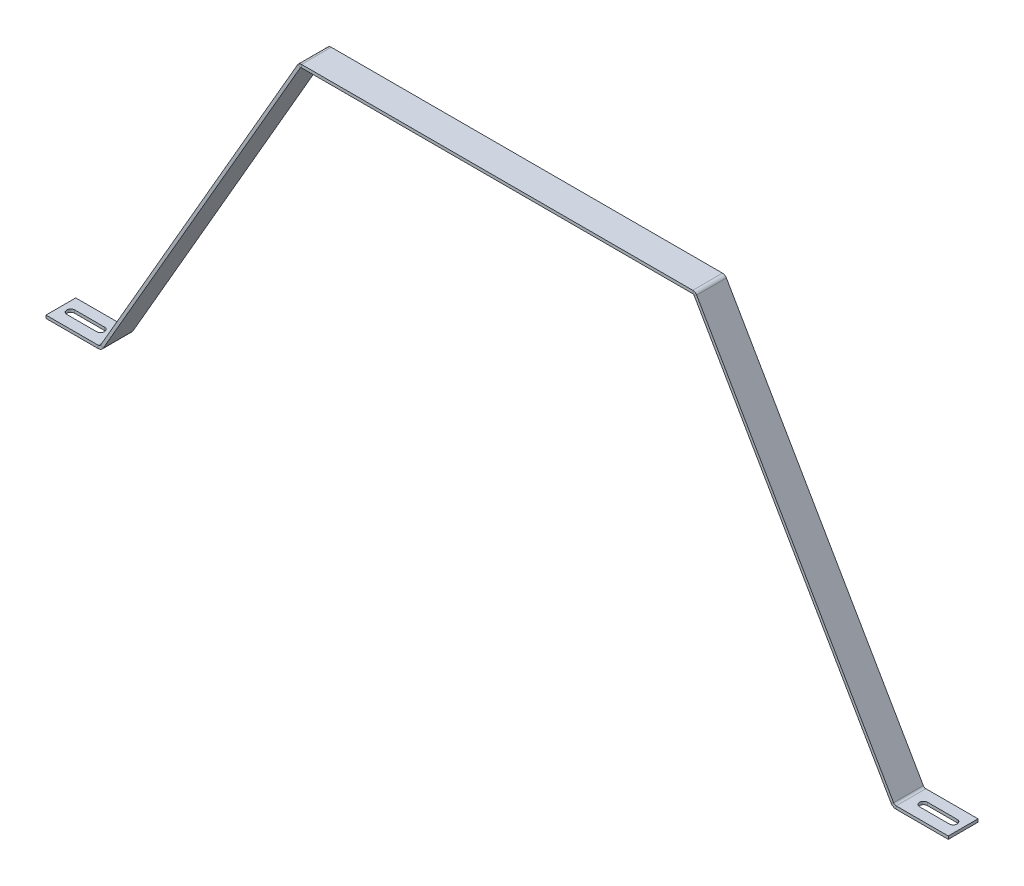
from build123d import *

# Parameters (mm, degrees)
EXTRUDE_1_DEPTH       = 15
CUT_EXTRUDE_1_REACH   = 576.925
SHEET_START           = -15
SHEET_METAL_2_DEPTH   = 30
SHEET_METAL_2_2_DEPTH = 30


# Read off the part's stored shape, not the designer's step: Преобразовать-Твердое тело2
with BuildPart() as part:
    # Эскиз1 → Вытянуть-Тонкостенный1 (new, symmetric)
    with BuildSketch(Plane.XY):
        with BuildLine():
            Line((-455.166025404, 195.187225691), (-402.598076211, 195.187225691))
            ThreePointArc((-402.598076211, 195.187225691), (-401.098076211, 195.58914948), (-400, 196.687225691))
            Line((-400, 196.687225691), (-200.433012702, 542.347387205))
            ThreePointArc((-200.433012702, 542.347387205), (-199.883974596, 542.896425311), (-199.133974596, 543.097387205))
            Line((-199.133974596, 543.097387205), (199.133974596, 543.097387205))
            ThreePointArc((199.133974596, 543.097387205), (199.883974596, 542.896425311), (200.433012702, 542.347387205))
            Line((200.433012702, 542.347387205), (400, 196.687225691))
            ThreePointArc((400, 196.687225691), (401.098076211, 195.58914948), (402.598076211, 195.187225691))
            Line((402.598076211, 195.187225691), (455.166025404, 195.187225691))
            Line((455.166025404, 195.187225691), (455.166025404, 192.187225691))
            Line((455.166025404, 192.187225691), (402.598076211, 192.187225691))
            ThreePointArc((402.598076211, 192.187225691), (399.598076211, 192.991073269), (397.401923789, 195.187225691))
            Line((397.401923789, 195.187225691), (198.267949192, 540.097387205))
            Line((198.267949192, 540.097387205), (-198.267949192, 540.097387205))
            Line((-198.267949192, 540.097387205), (-397.401923789, 195.187225691))
            ThreePointArc((-397.401923789, 195.187225691), (-399.598076211, 192.991073269), (-402.598076211, 192.187225691))
            Line((-402.598076211, 192.187225691), (-455.166025404, 192.187225691))
            Line((-455.166025404, 192.187225691), (-455.166025404, 195.187225691))
        make_face()
    extrude(amount=EXTRUDE_1_DEPTH, both=True)

    # Эскиз2 → Вырез-Вытянуть1 (cut, up to next)
    with BuildSketch(Plane.XZ.offset(-192.187225691), mode=Mode.PRIVATE) as cut_extrude_1_sk1:
        with BuildLine():
            Line((-445.16238786, -4), (-415.16238786, -4))
            ThreePointArc((-415.16238786, -4), (-411.16238786, 0), (-415.16238786, 4))
            Line((-415.16238786, 4), (-445.16238786, 4))
            ThreePointArc((-445.16238786, 4), (-449.16238786, 0), (-445.16238786, -4))
        make_face()
    cut_extrude_1_tool1 = extrude(cut_extrude_1_sk1.sketch, amount=-CUT_EXTRUDE_1_REACH, mode=Mode.PRIVATE) & part.part
    # Эскиз2 → Вырез-Вытянуть1 (cut, up to next)
    with BuildSketch(Plane.XZ.offset(-192.187225691), mode=Mode.PRIVATE) as cut_extrude_1_sk2:
        with BuildLine():
            Line((445.16238786, 4), (415.16238786, 4))
            ThreePointArc((415.16238786, 4), (411.16238786, 0), (415.16238786, -4))
            Line((415.16238786, -4), (445.16238786, -4))
            ThreePointArc((445.16238786, -4), (449.16238786, 0), (445.16238786, 4))
        make_face()
    cut_extrude_1_tool2 = extrude(cut_extrude_1_sk2.sketch, amount=-CUT_EXTRUDE_1_REACH, mode=Mode.PRIVATE) & part.part
    add(cut_extrude_1_tool1.solids().sort_by_distance((-430.162388, 192.187226, 0))[0], mode=Mode.SUBTRACT)
    add(cut_extrude_1_tool2.solids().sort_by_distance((430.162388, 192.187226, 0))[0], mode=Mode.SUBTRACT)

    # Sheet Metal 2 outline → Sheet Metal 2 (cut)
    with BuildSketch(Plane.XY.offset(SHEET_START)):
        with BuildLine():
            Line((199.133974596, 543.097387205), (197.401923789, 543.097387205))
            ThreePointArc((197.401923789, 543.097387205), (199.651923789, 542.494501522), (201.299038106, 540.847387205))
            Line((201.299038106, 540.847387205), (200.433012702, 542.347387205))
            ThreePointArc((200.433012702, 542.347387205), (199.883974596, 542.896425311), (199.133974596, 543.097387205))
        make_face()
        with BuildLine():
            ThreePointArc((-201.299038106, 540.847387205), (-199.651923789, 542.494501522), (-197.401923789, 543.097387205))
            Line((-197.401923789, 543.097387205), (-199.133974596, 543.097387205))
            ThreePointArc((-199.133974596, 543.097387205), (-199.883974596, 542.896425311), (-200.433012702, 542.347387205))
            Line((-200.433012702, 542.347387205), (-201.299038106, 540.847387205))
        make_face()
    extrude(amount=SHEET_METAL_2_DEPTH, mode=Mode.SUBTRACT)

    # Sheet Metal 2 2 outline → Sheet Metal 2 2 (add)
    with BuildSketch(Plane.XY.offset(SHEET_START)):
        with BuildLine():
            Line((198.267949192, 540.097387205), (197.401923789, 540.097387205))
            ThreePointArc((197.401923789, 540.097387205), (198.151923789, 539.896425311), (198.700961894, 539.347387205))
            Line((198.700961894, 539.347387205), (198.267949192, 540.097387205))
        make_face()
        with BuildLine():
            ThreePointArc((-198.700961894, 539.347387205), (-198.151923789, 539.896425311), (-197.401923789, 540.097387205))
            Line((-197.401923789, 540.097387205), (-198.267949192, 540.097387205))
            Line((-198.267949192, 540.097387205), (-198.700961894, 539.347387205))
        make_face()
    extrude(amount=SHEET_METAL_2_2_DEPTH)


solid = part.part
